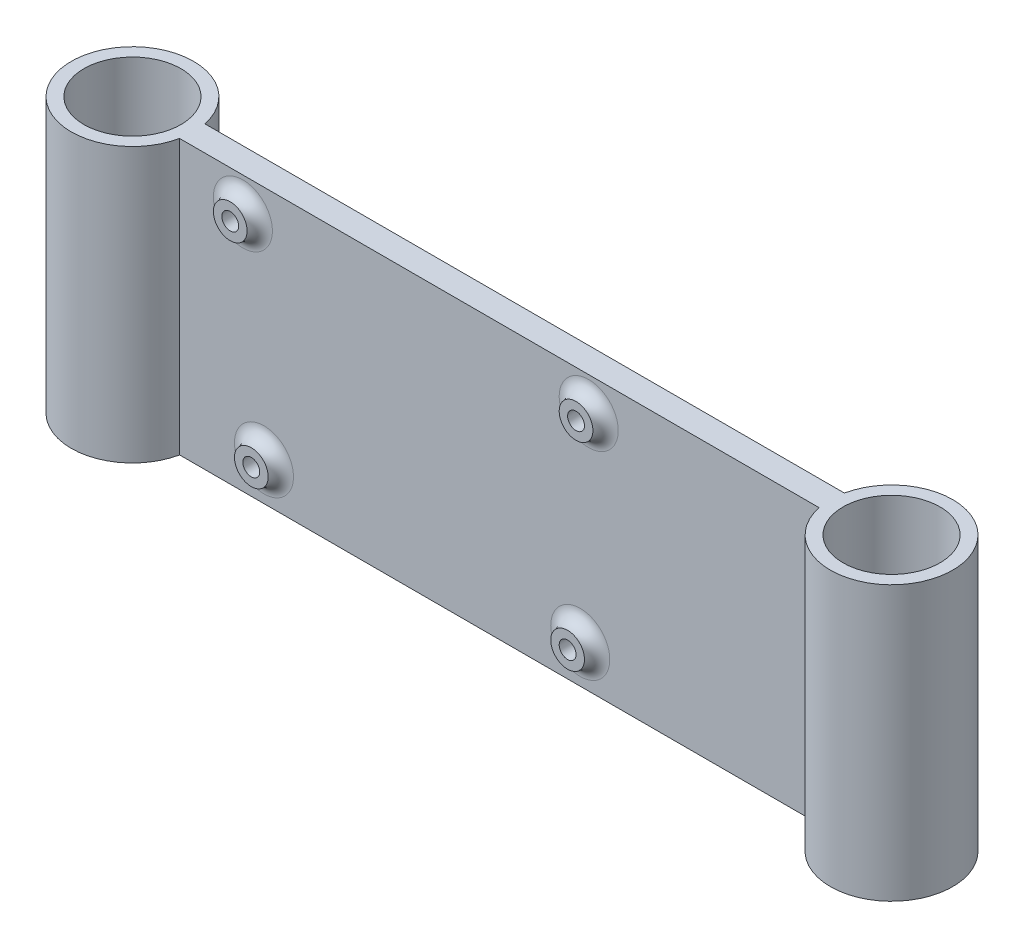
from build123d import *

# Parameters (mm, degrees)
SKETCH1_R           = 11.5
BOSS_EXTRUDE1_DEPTH = 65
SKETCH2_R           = 2
CUT_EXTRUDE1_DEPTH  = 10
BOSS_EXTRUDE2_START = 3
SKETCH3_R           = 4
SKETCH3_R_2         = 2
BOSS_EXTRUDE2_DEPTH = 3
FILLET1_R           = 3


with BuildPart() as part:
    # Sketch1 → Boss-Extrude1 (new body)
    with BuildSketch(Plane(origin=(0, 0, 0), x_dir=(1, 0, 0), z_dir=(0, 1, 0))):
        with BuildLine():
            Line((-28.353157483, 3), (123.274320599, 3))
            ThreePointArc((123.274320599, 3), (151.960581558, 0), (123.274320599, -3))
            Line((123.274320599, -3), (-28.353157483, -3))
            ThreePointArc((-28.353157483, -3), (-57.039418442, 0), (-28.353157483, 3))
        make_face()
        with Locations(Location((-42.539418442, 0, 0), (0, 0, 270))):
            Circle(SKETCH1_R, mode=Mode.SUBTRACT)
        with Locations(Location((137.460581558, 0, 0), (0, 0, 270))):
            Circle(SKETCH1_R, mode=Mode.SUBTRACT)
    extrude(amount=BOSS_EXTRUDE1_DEPTH)

    # Sketch2 → Cut-Extrude1 (cut)
    with BuildSketch(Plane.XY.offset(3)):
        with Locations((-13.353157483, 57)):
            Circle(SKETCH2_R)
        with Locations((-8.353157483, 9)):
            Circle(SKETCH2_R)
        with Locations((66.646842517, 9)):
            Circle(SKETCH2_R)
        with Locations((68.646842517, 57)):
            Circle(SKETCH2_R)
    extrude(amount=-CUT_EXTRUDE1_DEPTH, mode=Mode.SUBTRACT)

    # Sketch3 → Boss-Extrude2 (add)
    # profile 1 of 4: a face of its own
    with BuildSketch(Plane.XY.offset(3).offset(BOSS_EXTRUDE2_START)):
        with Locations(Location((-13.353157483, 57, 0), (0, 0, 180))):
            Circle(SKETCH3_R)
        with Locations((-13.353157483, 57)):
            Circle(SKETCH3_R_2, mode=Mode.SUBTRACT)
    # profile 2 of 4: a face of its own
    with BuildSketch(Plane.XY.offset(3).offset(BOSS_EXTRUDE2_START)):
        with Locations(Location((68.646842517, 57, 0), (0, 0, 180))):
            Circle(SKETCH3_R)
        with Locations((68.646842517, 57)):
            Circle(SKETCH3_R_2, mode=Mode.SUBTRACT)
    # profile 3 of 4: a face of its own
    with BuildSketch(Plane.XY.offset(3).offset(BOSS_EXTRUDE2_START)):
        with Locations(Location((-8.353157483, 9, 0), (0, 0, 180))):
            Circle(SKETCH3_R)
        with Locations((-8.353157483, 9)):
            Circle(SKETCH3_R_2, mode=Mode.SUBTRACT)
    # profile 4 of 4: a face of its own
    with BuildSketch(Plane.XY.offset(3).offset(BOSS_EXTRUDE2_START)):
        with Locations(Location((66.646842517, 9, 0), (0, 0, 180))):
            Circle(SKETCH3_R)
        with Locations((66.646842517, 9)):
            Circle(SKETCH3_R_2, mode=Mode.SUBTRACT)
    extrude(amount=-BOSS_EXTRUDE2_DEPTH)

    # Fillet1
    fillet1_edges = [part.edges().sort_by_distance(p)[0] for p in [
        (-9.353157483, 57, 3),
        (72.646842517, 57, 3),
        (-4.353157483, 9, 3),
        (70.646842517, 9, 3),
    ]]
    fillet(fillet1_edges, radius=FILLET1_R - 0.0001)  # a hair under: the kernel refuses the full size


solid = part.part
